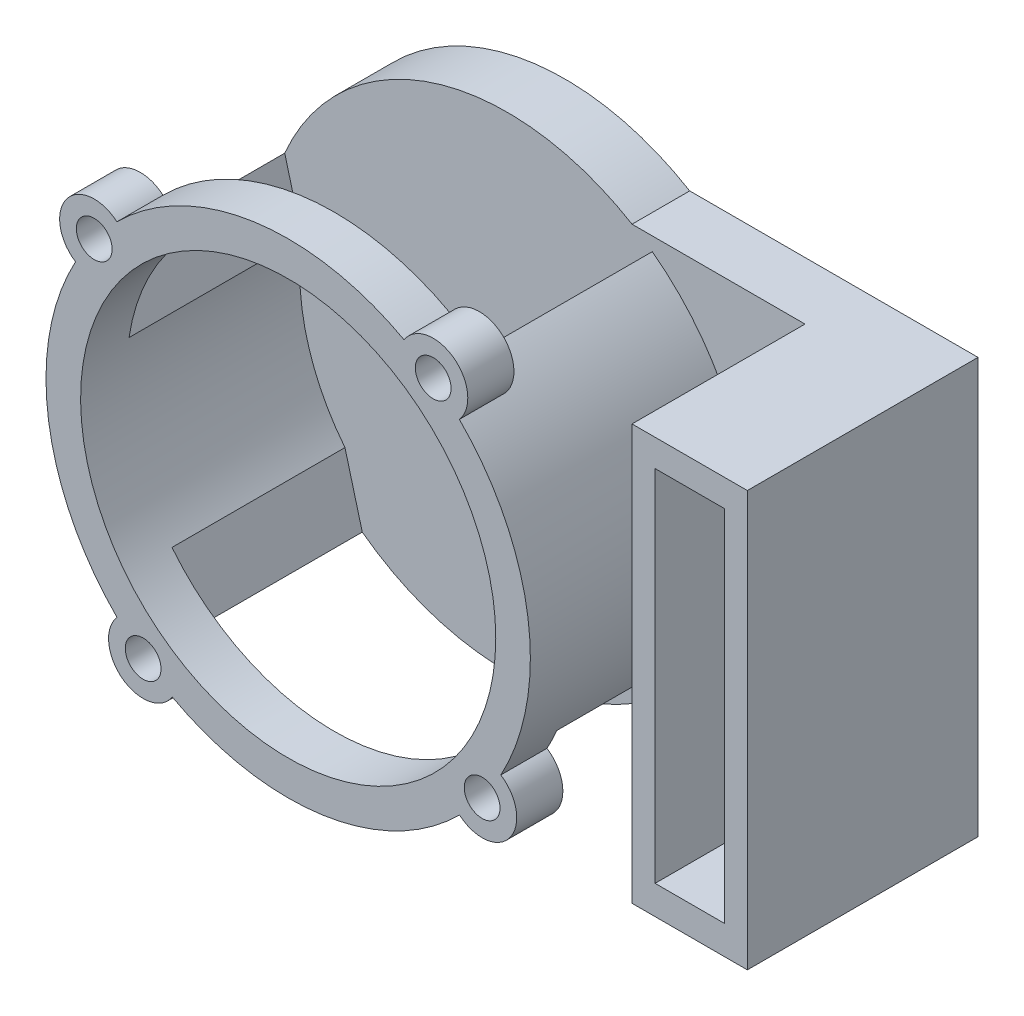
from build123d import *

# Parameters (mm, degrees)
ESTRUSIONE_ESTRUSIONE1_DEPTH = 2.5
SCHIZZO2_W                   = 10
SCHIZZO2_H                   = 36
ESTRUSIONE_ESTRUSIONE2_DEPTH = 15
SCHIZZO3_W                   = 6
SCHIZZO3_H                   = 31.15
TAGLIO_ESTRUSIONE1_DEPTH     = 13
ESTRUSIONE_SOTTILE1_START    = 19
SCHIZZO5_R                   = 21
SCHIZZO5_R_2                 = 18
ESTRUSIONE_SOTTILE1_DEPTH    = 19
SCHIZZO8_W                   = 33
SCHIZZO8_H                   = 15
TAGLIO_ESTRUSIONE2_DEPTH     = 68.177237764
SCHIZZO10_R                  = 3
ESTRUSIONE_ESTRUSIONE3_DEPTH = 4
FORO_PER_VITE_M2_5_1_D       = 3.1
FORO_PER_VITE_M2_5_1_DEPTH   = 3
FORO_PER_VITE_M2_5_1_TIP     = 0.931333959


with BuildPart() as part:
    # Schizzo1 → Estrusione-Estrusione1 (new, symmetric)
    with BuildSketch(Plane.XY):
        with BuildLine():
            Line((22.36549987, -24.390648792), (47.36549987, -24.390648792))
            Line((47.36549987, -24.390648792), (47.36549987, 11.609351208))
            Line((47.36549987, 11.609351208), (22.36549987, 11.609351208))
            ThreePointArc((22.36549987, 11.609351208), (-9.451153957, -6.390648792), (22.36549987, -24.390648792))
        make_face()
    extrude(amount=ESTRUSIONE_ESTRUSIONE1_DEPTH, both=True)

    # Schizzo2 → Estrusione-Estrusione2 (add)
    with BuildSketch(Plane.XY.offset(2.5)):
        with Locations((42.36549987, -6.390648792)):
            Rectangle(SCHIZZO2_W, SCHIZZO2_H)
    extrude(amount=ESTRUSIONE_ESTRUSIONE2_DEPTH)

    # Schizzo3 → Taglio-Estrusione1 (cut)
    with BuildSketch(Plane.XY.offset(17.5)):
        with Locations((42.36549987, -6.315648792)):
            Rectangle(SCHIZZO3_W, SCHIZZO3_H)
    extrude(amount=-TAGLIO_ESTRUSIONE1_DEPTH, mode=Mode.SUBTRACT)

    # Schizzo5 → Estrusione-Sottile1 (add)
    with BuildSketch(Plane.XY.offset(2.5).offset(ESTRUSIONE_SOTTILE1_START)):
        with Locations((11.548846043, -6.390648792)):
            Circle(SCHIZZO5_R)
        with Locations((11.548846043, -6.390648792)):
            Circle(SCHIZZO5_R_2, mode=Mode.SUBTRACT)
    extrude(amount=-ESTRUSIONE_SOTTILE1_DEPTH)

    # Schizzo8 → Taglio-Estrusione2 (cut, through all)
    with BuildSketch(Plane(origin=(-3.063911756, 11.434674345, 0), x_dir=(0.9659258262890695, 0.2588190451025161, 0), z_dir=(-0.2588190451025161, 0.9659258262890696, 0))):
        with Locations((9.501307039, -10)):
            Rectangle(SCHIZZO8_W, SCHIZZO8_H)
    extrude(amount=-TAGLIO_ESTRUSIONE2_DEPTH, mode=Mode.SUBTRACT)

    # Schizzo10 → Estrusione-Estrusione3 (add)
    with BuildSketch(Plane.XY.offset(21.5)):
        with Locations((-5.269412757, 6.184969321)):
            Circle(SCHIZZO10_R)
        with Locations((24.124464157, 10.427610008)):
            Circle(SCHIZZO10_R)
        with Locations((28.367104844, -18.966266905)):
            Circle(SCHIZZO10_R)
        with Locations((-1.02677207, -23.208907593)):
            Circle(SCHIZZO10_R)
    extrude(amount=-ESTRUSIONE_ESTRUSIONE3_DEPTH)

    # Foro per Vite M2.5-1
    with Locations(Plane(origin=(24.124464157, 10.427610008, 21.5), x_dir=(1, 0, 0), z_dir=(0, 0, 1))):
        with Locations((0, 0), (4.242640687, -29.393876913), (-25.151236227, -33.636517601), (-29.393876914, -4.242640687)):
            Hole(FORO_PER_VITE_M2_5_1_D / 2, depth=FORO_PER_VITE_M2_5_1_DEPTH)
            with Locations((0, 0, -(FORO_PER_VITE_M2_5_1_DEPTH + FORO_PER_VITE_M2_5_1_TIP / 2))):  # 118° drill point
                Cone(0, FORO_PER_VITE_M2_5_1_D / 2, FORO_PER_VITE_M2_5_1_TIP, mode=Mode.SUBTRACT)


solid = part.part
